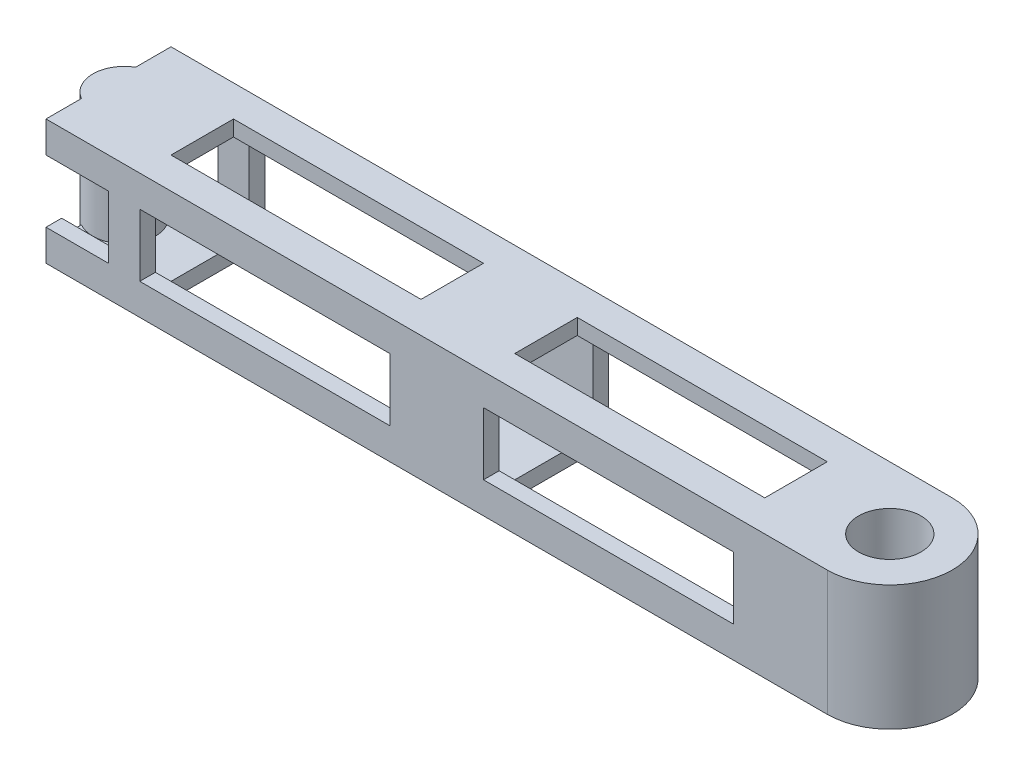
from build123d import *

# Parameters (mm, degrees)
SKETCH1_W               = 250
SKETCH1_H               = 40
BOSS_EXTRUDE1_DEPTH     = 40
CUT_EXTRUDE1_DEPTH      = 278.634133017
CUT_EXTRUDE1_DEPTH_BACK = 278.634133017
SKETCH2_W               = 30
SKETCH2_H               = 30
CUT_EXTRUDE2_DEPTH      = 178.338713683
CUT_EXTRUDE2_DEPTH_BACK = 178.338713683
SKETCH3_W               = 80
SKETCH3_H               = 20
CUT_EXTRUDE3_DEPTH      = 142.662654059
CUT_EXTRUDE3_DEPTH_BACK = 142.662654059
SKETCH4_W               = 80
SKETCH4_H               = 20
CUT_EXTRUDE4_DEPTH      = 178.338713683
CUT_EXTRUDE4_DEPTH_BACK = 178.338713683
SKETCH5_W               = 20
SKETCH5_H               = 20
SKETCH6_R               = 10
BOSS_EXTRUDE2_DEPTH     = 40
SKETCH7_R               = 20
BOSS_EXTRUDE3_DEPTH     = 40
CUT_EXTRUDE5_DEPTH      = 161.198094577
CUT_EXTRUDE5_DEPTH_BACK = 161.198094577
SKETCH8_R               = 10


with BuildPart() as part:
    # Sketch1 → Boss-Extrude1 (new body)
    with BuildSketch(Plane.XY):
        with Locations((4.87804878, -93.932926829)):
            Rectangle(SKETCH1_W, SKETCH1_H)
    extrude(amount=BOSS_EXTRUDE1_DEPTH)

    # Sketch2 → Cut-Extrude1 (cut, two sides: drawn at the far end of the back side and taken through both)
    with BuildSketch(Plane(origin=(129.87804878, 0, 0), x_dir=(0, 0, -1), z_dir=(1, 0, 0)).offset(-CUT_EXTRUDE1_DEPTH_BACK)):
        with Locations((-20, -93.932926829)):
            Rectangle(SKETCH2_W, SKETCH2_H)
    extrude(amount=CUT_EXTRUDE1_DEPTH + CUT_EXTRUDE1_DEPTH_BACK, mode=Mode.SUBTRACT)

    # Sketch3 → Cut-Extrude2 (cut, two sides: drawn at the far end of the back side and taken through both)
    with BuildSketch(Plane(origin=(0, 0, 0), x_dir=(-1, 0, 0), z_dir=(0, 0, -1)).offset(-CUT_EXTRUDE2_DEPTH_BACK)):
        with Locations((-59.87804878, -93.932926829)):
            Rectangle(SKETCH3_W, SKETCH3_H)
        with Locations((50.12195122, -93.932926829)):
            Rectangle(SKETCH3_W, SKETCH3_H)
    extrude(amount=CUT_EXTRUDE2_DEPTH + CUT_EXTRUDE2_DEPTH_BACK, mode=Mode.SUBTRACT)

    # Sketch4 → Cut-Extrude3 (cut, two sides: drawn at the far end of the back side and taken through both)
    with BuildSketch(Plane(origin=(0, -73.932926829, 0), x_dir=(1, 0, 0), z_dir=(0, 1, 0)).offset(-CUT_EXTRUDE3_DEPTH_BACK)):
        with Locations((59.87804878, -20)):
            Rectangle(SKETCH4_W, SKETCH4_H)
        with Locations((-50.12195122, -20)):
            Rectangle(SKETCH4_W, SKETCH4_H)
    extrude(amount=CUT_EXTRUDE3_DEPTH + CUT_EXTRUDE3_DEPTH_BACK, mode=Mode.SUBTRACT)

    # Sketch5 → Cut-Extrude4 (cut, two sides: drawn at the far end of the back side and taken through both)
    with BuildSketch(Plane.XY.offset(40).offset(-CUT_EXTRUDE4_DEPTH_BACK)):
        with Locations((-110.12195122, -93.932926829)):
            Rectangle(SKETCH5_W, SKETCH5_H)
    extrude(amount=CUT_EXTRUDE4_DEPTH + CUT_EXTRUDE4_DEPTH_BACK, mode=Mode.SUBTRACT)

    # Sketch6 → Boss-Extrude2 (add)
    with BuildSketch(Plane.XZ.offset(113.932926829)):
        with Locations((-115.12195122, 20)):
            Circle(SKETCH6_R)
    extrude(amount=-BOSS_EXTRUDE2_DEPTH)

    # Sketch7 → Boss-Extrude3 (add)
    with BuildSketch(Plane.XZ.offset(113.932926829)):
        with Locations((129.87804878, 20)):
            Circle(SKETCH7_R)
    extrude(amount=-BOSS_EXTRUDE3_DEPTH)

    # Sketch8 → Cut-Extrude5 (cut, two sides: drawn at the far end of the back side and taken through both)
    with BuildSketch(Plane(origin=(0, -113.932926829, 0), x_dir=(-1, 0, 0), z_dir=(0, -1, 0)).offset(-CUT_EXTRUDE5_DEPTH_BACK)):
        with Locations((-129.87804878, -20)):
            Circle(SKETCH8_R)
    extrude(amount=CUT_EXTRUDE5_DEPTH + CUT_EXTRUDE5_DEPTH_BACK, mode=Mode.SUBTRACT)


solid = part.part
